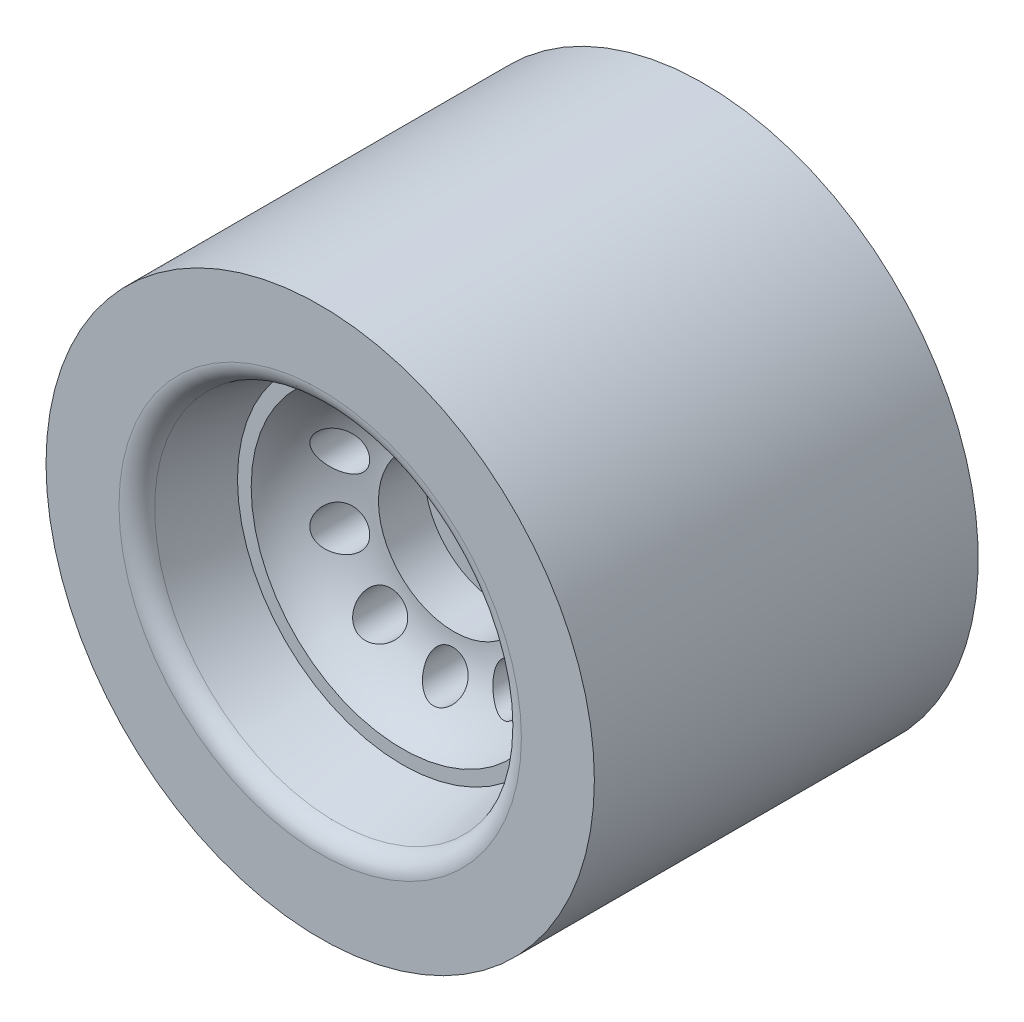
from build123d import *

# Parameters (mm, degrees)
SKETCH_1_R               = 40
EXTRUDE_1_DEPTH          = 28
SKETCH_2_R               = 8.5
CUT_EXTRUDE_1_DEPTH      = 80.598994969
SKETCH_5_R               = 3
CUT_EXTRUDE_2_DEPTH      = 64.118935352
PATTERN_CIRCULAR_1_COUNT = 10
FILLET_1_R               = 3
SKETCH_6_R               = 11
CUT_EXTRUDE_3_DEPTH      = 6.75
CUT_EXTRUDE_START        = -6.75
SKETCH_7_R               = 11
CUT_EXTRUDE_4_DEPTH      = 6.75


with BuildPart() as part:
    # 스케치1 → 보스-돌출1 (new, symmetric)
    with BuildSketch(Plane.XY):
        Circle(SKETCH_1_R)
    extrude(amount=EXTRUDE_1_DEPTH, both=True)

    # 스케치2 → 컷-돌출1 (cut, through all)
    with BuildSketch(Plane.XY.offset(28)):
        Circle(SKETCH_2_R)
    extrude(amount=-CUT_EXTRUDE_1_DEPTH, mode=Mode.SUBTRACT)

    # 스케치4 → 컷-회전1 (revolve, cut)
    with BuildSketch(Plane(origin=(0, 0, 0), x_dir=(0, 0, -1), z_dir=(1, 0, 0))):
        with BuildLine():
            Line((28, 40), (26.6, 33.9))
            Line((26.6, 33.9), (25.6, 33.4))
            ThreePointArc((25.6, 33.4), (25.036621757, 30.988428707), (24.205776693, 28.655454719))
            ThreePointArc((24.205776693, 28.655454719), (23.141333629, 25.422089147), (22.6083716, 22.06))
            ThreePointArc((22.6083716, 22.06), (17.154433029, 17.683921829), (15.1, 11))
            Line((15.1, 11), (15.1, 0))
            Line((15.1, 0), (28, 0))
            Line((28, 0), (28, 40))
        make_face()
        with BuildLine():
            Line((-28, 0), (-28, 27))
            Line((-28, 27), (-16.0083716, 24.06))
            Line((-16.0083716, 24.06), (-16.0083716, 22.06))
            ThreePointArc((-16.0083716, 22.06), (-10.554433029, 17.683921829), (-8.5, 11))
            Line((-8.5, 11), (-8.5, 0))
            Line((-8.5, 0), (-28, 0))
        make_face()
    revolve(axis=Axis((0, 0, -28), (0, 0, 1)), mode=Mode.SUBTRACT)

    # 스케치5 → 컷-돌출2 (cut, symmetric)
    with BuildSketch(Plane.XY):
        with Locations((0, 15.875)):
            Circle(SKETCH_5_R)
    cut_extrude_2 = extrude(amount=CUT_EXTRUDE_2_DEPTH, both=True, mode=Mode.SUBTRACT)

    # 원형 패턴1: 컷-돌출2 ×10 about axis
    pattern_circular_1_axis = Axis((0, 0, -28), (0, 0, 1))
    for i in range(1, PATTERN_CIRCULAR_1_COUNT):
        add(cut_extrude_2.rotate(pattern_circular_1_axis, i * 360 / PATTERN_CIRCULAR_1_COUNT), mode=Mode.SUBTRACT)

    # 필렛1
    fillet_1_edges = [part.edges().sort_by_distance(p)[0] for p in [
        (0, -27, 28),
    ]]
    fillet(fillet_1_edges, radius=FILLET_1_R)

    # 스케치6 → 컷-돌출3 (cut)
    with BuildSketch(Plane.XY.offset(8.5)):
        Circle(SKETCH_6_R)
    extrude(amount=-CUT_EXTRUDE_3_DEPTH, mode=Mode.SUBTRACT)

    # 스케치7 → 컷-돌출4 (cut)
    with BuildSketch(Plane(origin=(0, 0, -15.1), x_dir=(-1, 0, 0), z_dir=(0, 0, -1)).offset(CUT_EXTRUDE_START)):
        Circle(SKETCH_7_R)
    extrude(amount=CUT_EXTRUDE_4_DEPTH, mode=Mode.SUBTRACT)


solid = part.part
